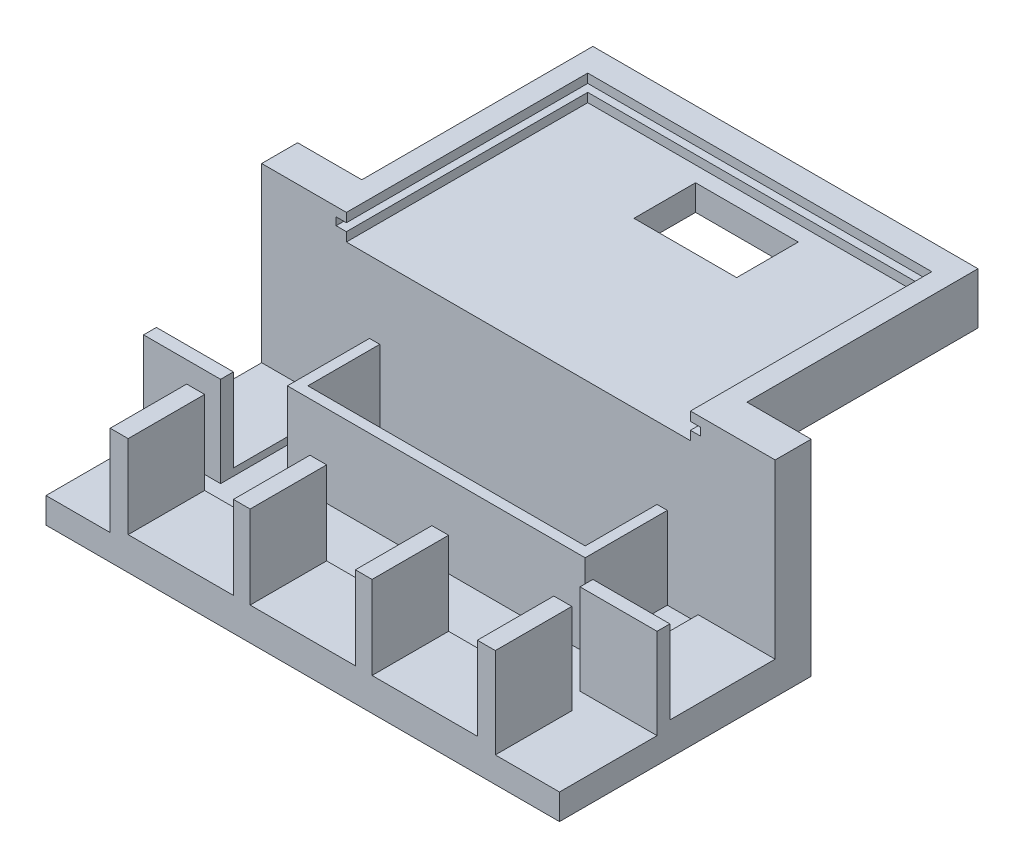
from build123d import *

# Parameters (mm, degrees)
CROQUIS1_W              = 100
CROQUIS1_H              = 49
SALIENTE_EXTRUIR1_DEPTH = 40
CROQUIS2_W              = 70
CROQUIS2_H              = 29
CORTAR_EXTRUIR1_DEPTH   = 35
CORTAR_EXTRUIR2_DEPTH   = 14.9
CORTAR_EXTRUIR4_DEPTH   = 119.325821358
CROQUIS6_W              = 20.5
CROQUIS6_H              = 16.2
CORTAR_EXTRUIR6_DEPTH   = 119.325821358
CROQUIS7_W              = 58
CROQUIS7_H              = 18
SALIENTE_EXTRUIR2_DEPTH = 16
CROQUIS8_W              = 54
CROQUIS8_H              = 14
CORTAR_EXTRUIR7_DEPTH   = 16
ENVOLVER2_START         = -2.5
ENVOLVER2_DEPTH         = 2.5
CROQUIS11_W             = 75
CROQUIS11_H             = 10
SALIENTE_EXTRUIR3_DEPTH = 44
CROQUIS12_W             = 67
CROQUIS12_H             = 45
CORTAR_EXTRUIR8_DEPTH   = 5
CROQUIS13_W             = 71
CROQUIS13_H             = 1.5
CORTAR_EXTRUIR9_DEPTH   = 54
CROQUIS14_W             = 20
CROQUIS14_H             = 12
CORTAR_EXTRUIR10_DEPTH  = 5
CORTAR_EXTRUIR11_REACH  = 144.299
CROQUIS5_W              = 20.5
CROQUIS5_H              = 16.2
CROQUIS15_W             = 75
CROQUIS15_H             = 10
SALIENTE_EXTRUIR4_DEPTH = 1
CROQUIS16_W             = 75
CROQUIS16_H             = 14.9
CROQUIS16_W_2           = 15
CROQUIS16_H_2           = 25
CORTAR_EXTRUIR12_DEPTH  = 2.4
SALIENTE_EXTRUIR5_DEPTH = 2


# Read off the part's stored shape, not the designer's step: Envolver2
with BuildPart() as part:
    # Croquis1 → Saliente-Extruir1 (new body)
    with BuildSketch(Plane(origin=(0, 0, 0), x_dir=(1, 0, 0), z_dir=(0, 1, 0))):
        with Locations((50, 24.5)):
            Rectangle(CROQUIS1_W, CROQUIS1_H)
    extrude(amount=SALIENTE_EXTRUIR1_DEPTH)

    # Croquis2 → Cortar-Extruir1 (cut)
    with BuildSketch(Plane(origin=(0, 40, 0), x_dir=(1, 0, 0), z_dir=(0, 1, 0))):
        with Locations((50, 29.5)):
            Rectangle(CROQUIS2_W, CROQUIS2_H)
    extrude(amount=-CORTAR_EXTRUIR1_DEPTH, mode=Mode.SUBTRACT)

    # Croquis3 → Cortar-Extruir2 (cut)
    with BuildSketch(Plane.XY):
        Polygon((12.5, 5), (12.5, 25), (87.5, 25), (87.5, 5), (100, 5), (100, 40), (0, 40), (0, 5), align=None)
    extrude(amount=-CORTAR_EXTRUIR2_DEPTH, mode=Mode.SUBTRACT)

    # Croquis4 → Cortar-Extruir4 (cut, through all)
    with BuildSketch(Plane.ZY):
        Polygon((-44, 25), (-19, 25), (-19, 5), (-14.9, 5), (-14.9, 40), (-44, 40), align=None)
    extrude(amount=-CORTAR_EXTRUIR4_DEPTH, mode=Mode.SUBTRACT)

    # Croquis6 → Cortar-Extruir6 (cut, through all)
    with BuildSketch(Plane(origin=(100, 0, 0), x_dir=(0, 0, -1), z_dir=(1, 0, 0))):
        with Locations((31.75, 14.5)):
            Rectangle(CROQUIS6_W, CROQUIS6_H)
    extrude(amount=-CORTAR_EXTRUIR6_DEPTH, mode=Mode.SUBTRACT)

    # Croquis7 → Saliente-Extruir2 (add)
    with BuildSketch(Plane(origin=(0, 5, 0), x_dir=(1, 0, 0), z_dir=(0, 1, 0))):
        with Locations((50, 35)):
            Rectangle(CROQUIS7_W, CROQUIS7_H)
    extrude(amount=SALIENTE_EXTRUIR2_DEPTH)

    # Croquis8 → Cortar-Extruir7 (cut)
    with BuildSketch(Plane(origin=(0, 21, 0), x_dir=(1, 0, 0), z_dir=(0, 1, 0))):
        with Locations((50, 35)):
            Rectangle(CROQUIS8_W, CROQUIS8_H)
    extrude(amount=-CORTAR_EXTRUIR7_DEPTH, mode=Mode.SUBTRACT)

    # Envolver2 outline → Envolver2 (cut)
    # profile 1 of 3: a face of its own
    with BuildSketch(Plane(origin=(0, 5, 0), x_dir=(1, 0, 0), z_dir=(0, 1, 0)).offset(ENVOLVER2_START)):
        with BuildLine():
            add(Edge.make_bspline(
                [(44.845927513, 22.682039813), (44.880502524, 22.681581101), (44.94779002, 22.680688388), (45.045978034, 22.678103561), (45.138406194, 22.671034857), (45.225422346, 22.663758255), (45.306894242, 22.652117669), (45.382891805, 22.638865253), (45.453428219, 22.622573117), (45.519399834, 22.604194379), (45.582065701, 22.58175166), (45.642294727, 22.553081251), (45.700763218, 22.518735345), (45.757273689, 22.477750733), (45.813128977, 22.432374893), (45.865885411, 22.37921084), (45.918377238, 22.321807714), (45.967578278, 22.25830401), (46.01447324, 22.191680732), (46.054376208, 22.120908747), (46.088223994, 22.047966819), (46.117214563, 21.973058038), (46.136979973, 21.894799291), (46.154181469, 21.814812457), (46.162464556, 21.732060085), (46.163897144, 21.676148523), (46.164618555, 21.647993057)],
                knots=[0, 0, 0, 0, 0.054369818, 0.105810783, 0.1543913, 0.200099433, 0.243069893, 0.283740822, 0.321360744, 0.356845277, 0.391373506, 0.42587086, 0.461574928, 0.497826917, 0.535543491, 0.574581255, 0.615459073, 0.657779879, 0.700797841, 0.743450957, 0.785305491, 0.827181235, 0.869502041, 0.912065543, 0.955718718, 1, 1, 1, 1], degree=3))
            Line((44.845927513, 22.682039813), (43.424314244, 22.682039813))
            Line((43.424314244, 22.682039813), (42.805172718, 18.976839617))
            Line((42.805172718, 18.976839617), (43.469342719, 18.976839617))
            Line((43.469342719, 18.976839617), (43.718607489, 20.469211918))
            Line((43.718607489, 20.469211918), (44.603095383, 20.469211918))
            Line((44.603095383, 20.469211918), (45.04292709, 18.976839617))
            Line((45.04292709, 18.976839617), (45.752929645, 18.976839617))
            Line((45.752929645, 18.976839617), (45.28977962, 20.548011749))
            add(Edge.make_bspline(
                [(46.164618555, 21.647993057), (46.164091676, 21.617670303), (46.163039403, 21.5571103), (46.151744736, 21.467468845), (46.13622668, 21.379126232), (46.112503265, 21.292592771), (46.082048693, 21.207680933), (46.044780457, 21.124441143), (46.001130757, 21.043108672), (45.951712013, 20.9635574), (45.895224481, 20.887990565), (45.830214645, 20.819272615), (45.758276279, 20.757071565), (45.678885267, 20.701205138), (45.592072867, 20.652370985), (45.497799172, 20.610367641), (45.396617343, 20.574987864), (45.325850603, 20.557119534), (45.28977962, 20.548011749)],
                knots=[0, 0, 0, 0, 0.059520551, 0.118873267, 0.177208837, 0.235565778, 0.294841411, 0.354222133, 0.414510544, 0.476000381, 0.538010758, 0.599455515, 0.661405537, 0.724496825, 0.78978963, 0.856706752, 0.926961053, 1, 1, 1, 1], degree=3))
        make_face()
        with BuildLine():
            add(Edge.make_bspline(
                [(44.743809366, 21.03528417), (44.778129381, 21.03600119), (44.843652036, 21.0373701), (44.937526666, 21.044910102), (45.022020151, 21.059216882), (45.097465695, 21.079213334), (45.164300411, 21.104537257), (45.221481868, 21.136836672), (45.270624581, 21.17399479), (45.32077283, 21.232312946), (45.36864261, 21.310567266), (45.413007527, 21.407196099), (45.438530205, 21.507321555), (45.442292151, 21.574957755), (45.444162962, 21.608593141)],
                knots=[0, 0, 0, 0, 0.099664188, 0.190275618, 0.273183536, 0.348129931, 0.416633313, 0.480054439, 0.538277477, 0.594505454, 0.702244126, 0.80362549, 0.902343236, 1, 1, 1, 1], degree=3))
            Line((44.743809366, 21.03528417), (43.812684837, 21.03528417))
            Line((43.812684837, 21.03528417), (43.993602816, 22.115967561))
            Line((43.993602816, 22.115967561), (44.735768567, 22.115967561))
            add(Edge.make_bspline(
                [(45.444162962, 21.608593141), (45.443321191, 21.636863214), (45.441681994, 21.691914124), (45.421908744, 21.770970842), (45.392768442, 21.844328967), (45.35019923, 21.909220717), (45.300609579, 21.965653441), (45.246923641, 22.013950522), (45.187891151, 22.050903022), (45.122329195, 22.077622199), (45.046506806, 22.09459194), (44.957252302, 22.107151834), (44.85196106, 22.115045121), (44.776255138, 22.115646142), (44.735768567, 22.115967561)],
                knots=[0, 0, 0, 0, 0.084973229, 0.165470167, 0.24404472, 0.32176826, 0.397881214, 0.469968558, 0.538528016, 0.606605512, 0.682202732, 0.771959831, 0.878046995, 1, 1, 1, 1], degree=3))
        make_face(mode=Mode.SUBTRACT)
    # profile 2 of 3: a face of its own
    with BuildSketch(Plane(origin=(0, 5, 0), x_dir=(1, 0, 0), z_dir=(0, 1, 0)).offset(ENVOLVER2_START)):
        Polygon((46.976739258, 22.682039813), (46.357597732, 18.976839617), (48.79395984, 18.976839617), (48.892057588, 19.542911869), (47.113432841, 19.542911869), (47.285505941, 20.572134146), (48.696666171, 20.572134146), (48.78913536, 21.138206398), (47.379583289, 21.138206398), (47.54281151, 22.115967561), (49.257109864, 22.115967561), (49.355207612, 22.682039813), align=None)
    # profile 3 of 3: a face of its own
    with BuildSketch(Plane(origin=(0, 5, 0), x_dir=(1, 0, 0), z_dir=(0, 1, 0)).offset(ENVOLVER2_START)):
        Polygon((50.984273497, 22.682039813), (49.96148386, 22.682039813), (49.342342334, 18.976839617), (49.858561632, 18.976839617), (50.417397165, 22.321007936), (50.952914381, 18.976839617), (51.313946257, 18.976839617), (52.891551028, 22.350758892), (52.327086936, 18.976839617), (52.991256936, 18.976839617), (53.611202541, 22.682039813), (52.559466028, 22.682039813), (51.387921608, 20.172506434), align=None)
    extrude(amount=ENVOLVER2_DEPTH, mode=Mode.SUBTRACT)

    # Croquis11 → Saliente-Extruir3 (add)
    with BuildSketch(Plane(origin=(0, 0, -49), x_dir=(-1, 0, 0), z_dir=(0, 0, -1))):
        with Locations((-50, 35)):
            Rectangle(CROQUIS11_W, CROQUIS11_H)
    extrude(amount=SALIENTE_EXTRUIR3_DEPTH)

    # Croquis12 → Cortar-Extruir8 (cut)
    with BuildSketch(Plane(origin=(0, 40, 0), x_dir=(1, 0, 0), z_dir=(0, 1, 0))):
        with Locations((50, 66.5)):
            Rectangle(CROQUIS12_W, CROQUIS12_H)
    extrude(amount=-CORTAR_EXTRUIR8_DEPTH, mode=Mode.SUBTRACT)

    # Croquis13 → Cortar-Extruir9 (cut)
    with BuildSketch(Plane.XY.offset(-44)):
        with Locations((50, 37.5)):
            Rectangle(CROQUIS13_W, CROQUIS13_H)
    extrude(amount=-CORTAR_EXTRUIR9_DEPTH, mode=Mode.SUBTRACT)

    # Croquis14 → Cortar-Extruir10 (cut)
    with BuildSketch(Plane(origin=(0, 35, 0), x_dir=(1, 0, 0), z_dir=(0, 1, 0))):
        with Locations((50.5, 80)):
            Rectangle(CROQUIS14_W, CROQUIS14_H)
    extrude(amount=-CORTAR_EXTRUIR10_DEPTH, mode=Mode.SUBTRACT)

    # Croquis5 → Cortar-Extruir11 (cut, up to next)
    with BuildSketch(Plane.XY, mode=Mode.PRIVATE) as cortar_extruir11_sk1:
        with Locations((26.25, 14.5)):
            Rectangle(CROQUIS5_W, CROQUIS5_H)
    cortar_extruir11_tool1 = extrude(cortar_extruir11_sk1.sketch, amount=-CORTAR_EXTRUIR11_REACH, mode=Mode.PRIVATE) & part.part
    # Croquis5 → Cortar-Extruir11 (cut, up to next)
    with BuildSketch(Plane.XY, mode=Mode.PRIVATE) as cortar_extruir11_sk2:
        with Locations((50, 14.5)):
            Rectangle(CROQUIS5_W, CROQUIS5_H)
    cortar_extruir11_tool2 = extrude(cortar_extruir11_sk2.sketch, amount=-CORTAR_EXTRUIR11_REACH, mode=Mode.PRIVATE) & part.part
    # Croquis5 → Cortar-Extruir11 (cut, up to next)
    with BuildSketch(Plane.XY, mode=Mode.PRIVATE) as cortar_extruir11_sk3:
        with Locations((73.75, 14.5)):
            Rectangle(CROQUIS5_W, CROQUIS5_H)
    cortar_extruir11_tool3 = extrude(cortar_extruir11_sk3.sketch, amount=-CORTAR_EXTRUIR11_REACH, mode=Mode.PRIVATE) & part.part
    add(cortar_extruir11_tool1.solids().sort_by_distance((26.25, 14.5, 0))[0], mode=Mode.SUBTRACT)
    add(cortar_extruir11_tool2.solids().sort_by_distance((50, 14.5, 0))[0], mode=Mode.SUBTRACT)
    add(cortar_extruir11_tool3.solids().sort_by_distance((73.75, 14.5, 0))[0], mode=Mode.SUBTRACT)

    # Croquis15 → Saliente-Extruir4 (add)
    with BuildSketch(Plane(origin=(0, 0, -93), x_dir=(-1, 0, 0), z_dir=(0, 0, -1))):
        with Locations((-50, 35)):
            Rectangle(CROQUIS15_W, CROQUIS15_H)
    extrude(amount=SALIENTE_EXTRUIR4_DEPTH)

    # Croquis16 → Cortar-Extruir12 (cut)
    with BuildSketch(Plane(origin=(0, 25, 0), x_dir=(1, 0, 0), z_dir=(0, 1, 0))):
        with Locations((50, 7.45)):
            Rectangle(CROQUIS16_W, CROQUIS16_H)
        with Locations((7.5, 31.5)):
            Rectangle(CROQUIS16_W_2, CROQUIS16_H_2)
        with Locations((92.5, 31.5)):
            Rectangle(CROQUIS16_W_2, CROQUIS16_H_2)
    extrude(amount=-CORTAR_EXTRUIR12_DEPTH, mode=Mode.SUBTRACT)

    # Croquis17 → Saliente-Extruir5 (add)
    with BuildSketch(Plane.XY.offset(-44)):
        Polygon((0, 40), (16.5, 40), (16.5, 38.25), (14.5, 38.25), (14.5, 36.75), (16.5, 36.75), (16.5, 35), (83.5, 35), (83.5, 36.75), (85.5, 36.75), (85.5, 38.25), (83.5, 38.25), (83.5, 40), (100, 40), (100, 22.6), (85, 22.6), (85, 5), (79, 5), (79, 21), (21, 21), (21, 5), (15, 5), (15, 22.6), (0, 22.6), align=None)
    extrude(amount=SALIENTE_EXTRUIR5_DEPTH)


solid = part.part
